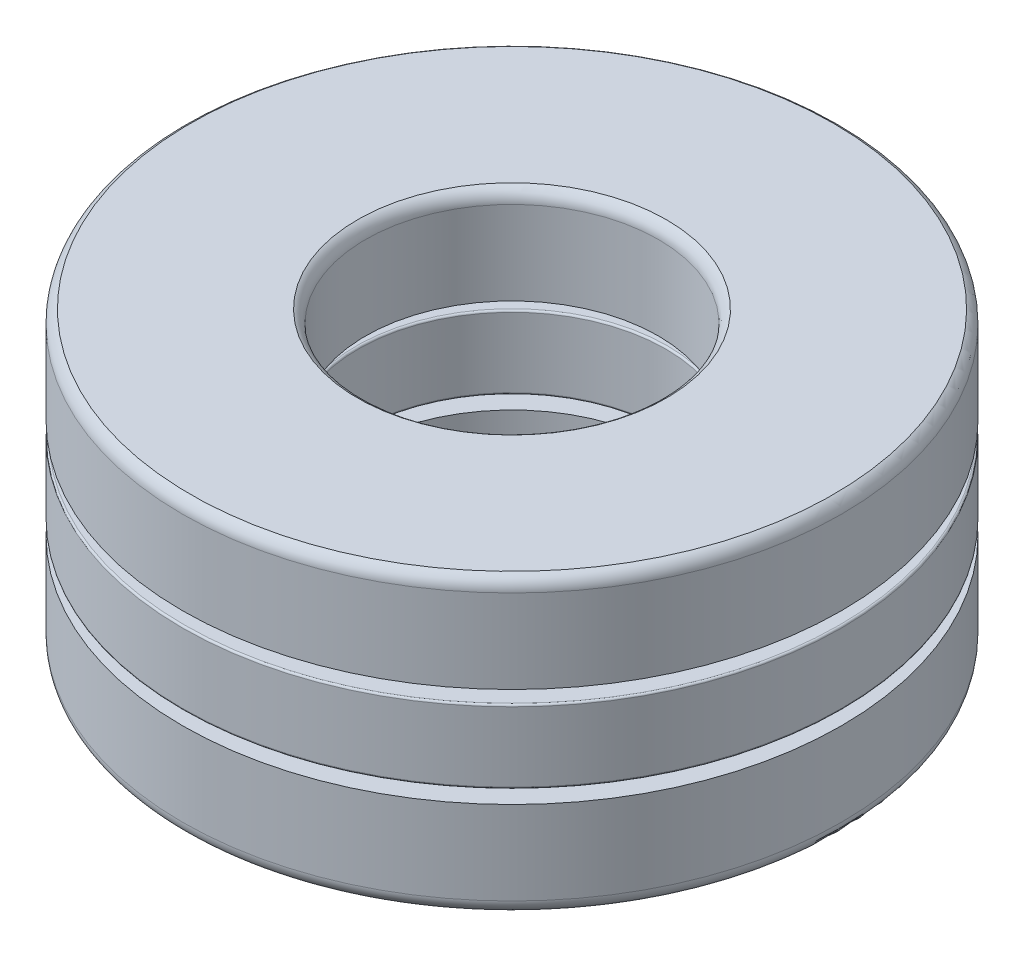
from build123d import *

# Parameters (mm, degrees)
CIRPATTERN1_COUNT = 7
CIRPATTERN2_COUNT = 7


# Read off the part's stored shape, not the designer's step: Cut-Revolve1
with BuildPart() as part:
    # Sketch3 → Revolve1 (revolve)
    with BuildSketch(Plane(origin=(0, 0, 0), x_dir=(0, 0, -1), z_dir=(1, 0, 0))):
        with BuildLine():
            Line((4.5, 0.68), (3.889576119, 0.68))
            ThreePointArc((3.889576119, 0.68), (3.3, 0.9), (2.710423881, 0.68))
            Line((2.710423881, 0.68), (2, 0.68))
            Line((2, 0.68), (2, 1.821394289))
            ThreePointArc((2, 1.821394289), (2.029706136, 1.926275174), (2.11, 2))
            Line((2.11, 2), (4.39, 2))
            ThreePointArc((4.39, 2), (4.470293864, 1.926275174), (4.5, 1.821394289))
            Line((4.5, 1.821394289), (4.5, 0.68))
        make_face()
        with BuildLine():
            Line((2.710423881, -0.68), (2.1, -0.68))
            Line((2.1, -0.68), (2.1, -1.821394289))
            ThreePointArc((2.1, -1.821394289), (2.129706136, -1.926275174), (2.21, -2))
            Line((2.21, -2), (4.39, -2))
            ThreePointArc((4.39, -2), (4.470293864, -1.926275174), (4.5, -1.821394289))
            Line((4.5, -1.821394289), (4.5, -0.68))
            Line((4.5, -0.68), (3.889576119, -0.68))
            ThreePointArc((3.889576119, -0.68), (3.3, -0.9), (2.710423881, -0.68))
        make_face()
        with BuildLine():
            Line((4.475, 0.5), (2.125, 0.5))
            ThreePointArc((2.125, 0.5), (2.10732233, 0.49267767), (2.1, 0.475))
            Line((2.1, 0.475), (2.1, -0.475))
            ThreePointArc((2.1, -0.475), (2.10732233, -0.49267767), (2.125, -0.5))
            Line((2.125, -0.5), (4.475, -0.5))
            ThreePointArc((4.475, -0.5), (4.49267767, -0.49267767), (4.5, -0.475))
            Line((4.5, -0.475), (4.5, 0.475))
            ThreePointArc((4.5, 0.475), (4.49267767, 0.49267767), (4.475, 0.5))
        make_face()
    revolve(axis=Axis((0, -2, 0), (0, 1, 0)))

    # Cut-Revolve1 outline → Cut-Revolve1 (revolve, cut)
    with BuildSketch(Plane.XY.offset(-3.3)):
        with BuildLine():
            Line((0.801888396, 0.500000001), (0, 0.500000001))
            Line((0, 0.500000001), (0, -0.500000001))
            Line((0, -0.500000001), (0.801888396, -0.500000001))
            ThreePointArc((0.801888396, -0.500000001), (0.945, 0), (0.801888396, 0.500000001))
        make_face()
    cut_revolve1 = revolve(axis=Axis((0, 0, -3.3), (0, 1, 0)), mode=Mode.SUBTRACT)

    # CirPattern2: Cut-Revolve1 ×7 about axis
    cirpattern2_axis = Axis((0, 0, 0), (0, 1, 0))
    for i in range(1, CIRPATTERN2_COUNT):
        add(cut_revolve1.rotate(cirpattern2_axis, i * 360 / CIRPATTERN2_COUNT), mode=Mode.SUBTRACT)


with BuildPart() as body_2:
    # Sketch4 → Revolve2 (revolve)
    with BuildSketch(Plane(origin=(0, 0, 0), x_dir=(0, 0, -1), z_dir=(1, 0, 0))):
        with BuildLine():
            Line((3.3, -0.9), (3.3, 0.9))
            ThreePointArc((3.3, 0.9), (2.4, 0), (3.3, -0.9))
        make_face()
    revolve(axis=Axis((0, 2, -3.3), (0, -1, 0)))


with BuildPart() as cirpattern1_1:
    # CirPattern1: pattern copy
    add(body_2.part.rotate(Axis((0, 0, 0), (0, 1, 0)), 1 * 360 / CIRPATTERN1_COUNT))


with BuildPart() as cirpattern1_2:
    # CirPattern1: pattern copy
    add(body_2.part.rotate(Axis((0, 0, 0), (0, 1, 0)), 2 * 360 / CIRPATTERN1_COUNT))


with BuildPart() as cirpattern1_3:
    # CirPattern1: pattern copy
    add(body_2.part.rotate(Axis((0, 0, 0), (0, 1, 0)), 3 * 360 / CIRPATTERN1_COUNT))


with BuildPart() as cirpattern1_4:
    # CirPattern1: pattern copy
    add(body_2.part.rotate(Axis((0, 0, 0), (0, 1, 0)), 4 * 360 / CIRPATTERN1_COUNT))


with BuildPart() as cirpattern1_5:
    # CirPattern1: pattern copy
    add(body_2.part.rotate(Axis((0, 0, 0), (0, 1, 0)), 5 * 360 / CIRPATTERN1_COUNT))


with BuildPart() as cirpattern1_6:
    # CirPattern1: pattern copy
    add(body_2.part.rotate(Axis((0, 0, 0), (0, 1, 0)), 6 * 360 / CIRPATTERN1_COUNT))


solid = Compound([part.part, body_2.part, cirpattern1_1.part, cirpattern1_2.part, cirpattern1_3.part, cirpattern1_4.part, cirpattern1_5.part, cirpattern1_6.part])
